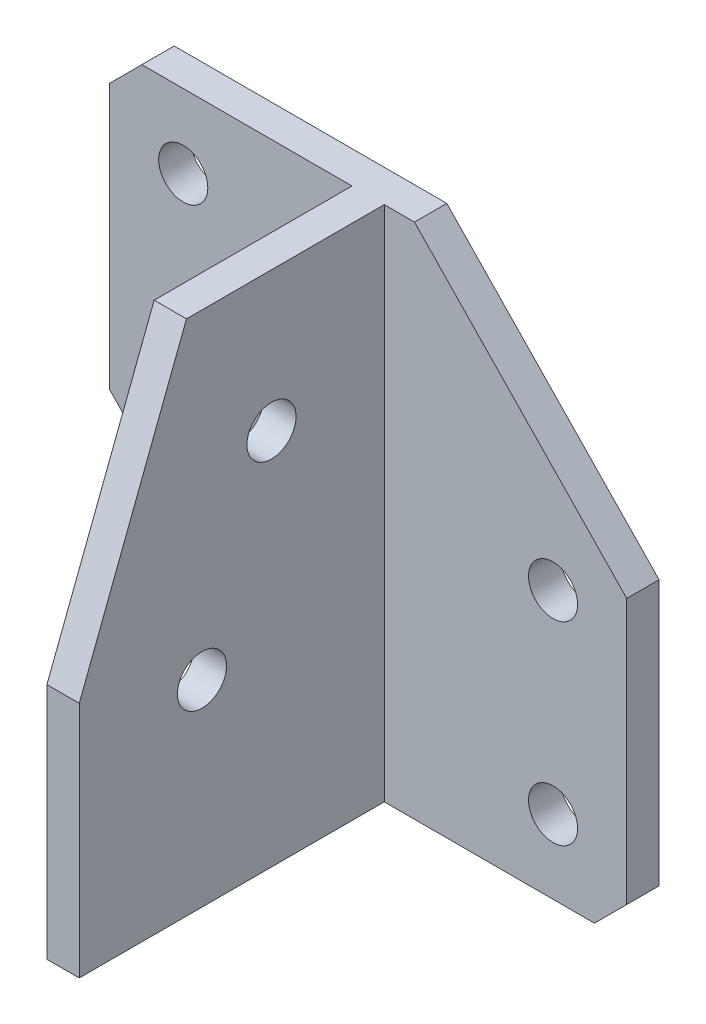
from build123d import *

# Parameters (mm, degrees)
BOSS_EXTRUDE1_DEPTH = 50.8
CUT_EXTRUDE1_DEPTH  = 67.953216029
SKETCH4_R           = 2.413
CUT_EXTRUDE2_DEPTH  = 67.953216029
CUT_EXTRUDE4_DEPTH  = 67.764856308
SKETCH5_R           = 2.413
CUT_EXTRUDE3_DEPTH  = 65.387338986
CHAMFER2_SIZE       = 3.175


with BuildPart() as part:
    # Sketch1 → Boss-Extrude1 (new body)
    with BuildSketch(Plane(origin=(0, 0, 0), x_dir=(1, 0, 0), z_dir=(0, 1, 0))):
        Polygon((-2.309090909, -33.890719697), (0.865909091, -33.890719697), (0.865909091, 1.034280303), (24.678409091, 1.034280303), (24.678409091, 4.209280303), (-26.121590909, 4.209280303), (-26.121590909, 1.034280303), (-2.309090909, 1.034280303), align=None)
    extrude(amount=BOSS_EXTRUDE1_DEPTH)

    # Sketch2 → Cut-Extrude1 (cut, through all)
    with BuildSketch(Plane.XY.offset(-1.034280303)):
        Polygon((3.829188443, 50.8), (24.678409091, 29.21), (24.678409091, 50.8), align=None)
        Polygon((-5.272370261, 0), (-26.121590909, 21.59), (-26.121590909, 0), align=None)
    extrude(amount=-CUT_EXTRUDE1_DEPTH, mode=Mode.SUBTRACT)

    # Sketch4 → Cut-Extrude2 (cut, through all)
    with BuildSketch(Plane.XY.offset(-1.034280303)):
        with Locations((-18.882590909, 43.561)):
            Circle(SKETCH4_R)
        with Locations((-18.882590909, 24.511)):
            Circle(SKETCH4_R)
        with Locations((17.439409091, 7.239)):
            Circle(SKETCH4_R)
        with Locations((17.439409091, 26.289)):
            Circle(SKETCH4_R)
    extrude(amount=-CUT_EXTRUDE2_DEPTH, mode=Mode.SUBTRACT)

    # Sketch6 → Cut-Extrude4 (cut, through all)
    with BuildSketch(Plane(origin=(0.865909091, 0, 0), x_dir=(0, 0, -1), z_dir=(1, 0, 0))):
        Polygon((-18.396719697, 50.8), (-28.926877906, 23.368), (-28.926877906, 0), (-33.890719697, 0), (-33.890719697, 50.8), align=None)
    extrude(amount=-CUT_EXTRUDE4_DEPTH, mode=Mode.SUBTRACT)

    # Sketch5 → Cut-Extrude3 (cut, through all)
    with BuildSketch(Plane(origin=(0.865909091, 0, 0), x_dir=(0, 0, -1), z_dir=(1, 0, 0))):
        with Locations((-16.872719697, 19.331718742)):
            Circle(SKETCH5_R)
        with Locations((-10.045810258, 37.116425867)):
            Circle(SKETCH5_R)
    extrude(amount=-CUT_EXTRUDE3_DEPTH, mode=Mode.SUBTRACT)

    # Chamfer2
    chamfer2_edges = [part.edges().sort_by_distance(p)[0] for p in [
        (24.678409091, 0, -2.621780303),
        (-26.121590909, 50.8, -2.621780303),
    ]]
    chamfer(chamfer2_edges, length=CHAMFER2_SIZE)


solid = part.part
